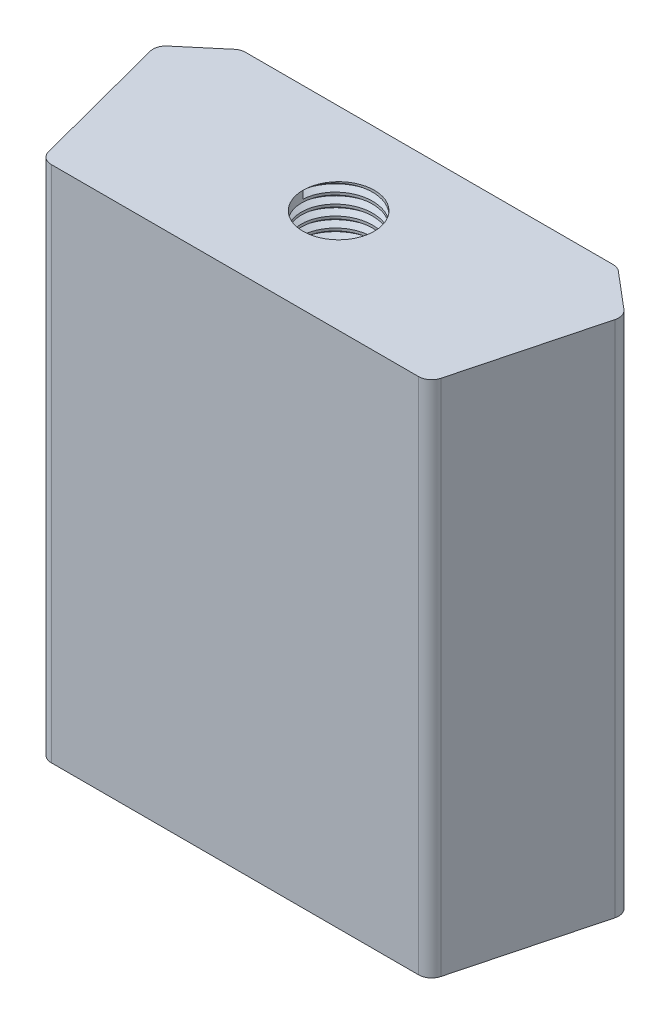
from build123d import *
from build123d.topology import SkipClean

# Parameters (mm, degrees)
BOSS_EXTRUDE1_DEPTH = 40
SKETCH3_R           = 2.75
CUT_EXTRUDE1_DEPTH  = 10
THREAD1_PITCH       = 0.8


with BuildPart() as part:
    # Sketch1 → Boss-Extrude1 (new body)
    with BuildSketch(Plane(origin=(0, 0, 0), x_dir=(1, 0, 0), z_dir=(0, 1, 0))):
        with BuildLine():
            Line((-14.178620776, -8), (14.178620776, -8))
            ThreePointArc((14.178620776, -8), (14.789399734, -7.791801152), (15.145851741, -7.253898128))
            Line((15.145851741, -7.253898128), (17.939776994, 3.389626646))
            ThreePointArc((17.939776994, 3.389626646), (17.926022481, 3.944992277), (17.618005902, 4.407318956))
            Line((17.618005902, 4.407318956), (14.829510217, 6.763794182))
            ThreePointArc((14.829510217, 6.763794182), (14.527711383, 6.939093761), (14.184050345, 7))
            Line((14.184050345, 7), (-14.184050345, 7))
            ThreePointArc((-14.184050345, 7), (-14.527711383, 6.939093761), (-14.829510217, 6.763794182))
            Line((-14.829510217, 6.763794182), (-17.618005902, 4.407318956))
            ThreePointArc((-17.618005902, 4.407318956), (-17.926022481, 3.944992277), (-17.939776994, 3.389626646))
            Line((-17.939776994, 3.389626646), (-15.145851741, -7.253898128))
            ThreePointArc((-15.145851741, -7.253898128), (-14.789399734, -7.791801152), (-14.178620776, -8))
        make_face()
    extrude(amount=BOSS_EXTRUDE1_DEPTH)

    # Sketch3 → Cut-Extrude1 (cut)
    with BuildSketch(Plane(origin=(0, 40, 0), x_dir=(1, 0, 0), z_dir=(0, 1, 0))):
        with Locations(Location((0, 0, 0), (0, 0, 270))):
            Circle(SKETCH3_R)
    extrude(amount=-CUT_EXTRUDE1_DEPTH, mode=Mode.SUBTRACT)

    # Thread1: the profile of Thread Profile1 profile screwed along a right-hand helix of 12.5 turns, 8 arcs to a turn; built about Z, then put on its axis
    with SkipClean():  # the faces are left unmerged after this step: merging them gives an invalid solid
        thread1_z = Axis((0, 0, 0), (0, 0, 1))
        thread1_corners = [(2.7497, 0, -0.000173205), (3.1830127, 0, 0.249999999), (3.1830127, 0, 0.349999999), (2.7497, 0, 0.600173203)]
        with BuildLine(mode=Mode.PRIVATE) as thread1_profile:
            Line(thread1_corners[0], thread1_corners[1])
            Line(thread1_corners[1], thread1_corners[2])
            Line(thread1_corners[2], thread1_corners[3])
            Line(thread1_corners[3], thread1_corners[0])
        thread1_cap = Face(thread1_profile.wire())
        thread1_turn_angles = [0, 22.5, 45, 67.5, 90, 112.5, 135, 157.5, 180, 202.5, 225, 247.5, 270, 292.5, 315, 337.5, 360]
        thread1_turn_weights = [1, 0.9238795325112867, 1, 0.9238795325112867, 1, 0.9238795325112867, 1, 0.9238795325112867, 1, 0.9238795325112867, 1, 0.9238795325112867, 1, 0.9238795325112867, 1, 0.9238795325112867, 1]
        thread1_turn_rails = [Edge.make_bspline([Vector(p[0], p[1], 0).rotate(thread1_z, thread1_turn_angles[k]) / thread1_turn_weights[k] + Vector(0, 0, p[2] + THREAD1_PITCH * thread1_turn_angles[k] / 360) for k in range(17)], [0, 0, 0, 1, 1, 2, 2, 3, 3, 4, 4, 5, 5, 6, 6, 7, 7, 8, 8, 8], 2, thread1_turn_weights) for p in thread1_corners]
        thread1_turn_sides = [Face.make_surface_from_curves(thread1_turn_rails[p[0]], thread1_turn_rails[p[1]]) for p in [(0, 1), (1, 2), (2, 3), (3, 0)]]
        thread1_last_angles = [4320, 4342.5, 4365, 4387.5, 4410, 4432.5, 4455, 4477.5, 4500]
        thread1_last_weights = [1, 0.9238795325112867, 1, 0.9238795325112867, 1, 0.9238795325112867, 1, 0.9238795325112867, 1]
        thread1_last_rails = [Edge.make_bspline([Vector(p[0], p[1], 0).rotate(thread1_z, thread1_last_angles[k]) / thread1_last_weights[k] + Vector(0, 0, p[2] + THREAD1_PITCH * thread1_last_angles[k] / 360) for k in range(9)], [0, 0, 0, 1, 1, 2, 2, 3, 3, 4, 4, 4], 2, thread1_last_weights) for p in thread1_corners]
        thread1_last_sides = [Face.make_surface_from_curves(thread1_last_rails[p[0]], thread1_last_rails[p[1]]) for p in [(0, 1), (1, 2), (2, 3), (3, 0)]]
        thread1 = Plane(origin=(0, 40, 0), x_dir=(-1, 0, 0), z_dir=(0, -1, 0)) * Solid(Shell([*[p.moved(Location((0, 0, THREAD1_PITCH * i))) for i in range(12) for p in thread1_turn_sides], *thread1_last_sides, thread1_cap, thread1_cap.rotate(thread1_z, 4500).moved(Location((0, 0, THREAD1_PITCH * 4500 / 360)))]))
        add(thread1, mode=Mode.SUBTRACT)


solid = part.part
